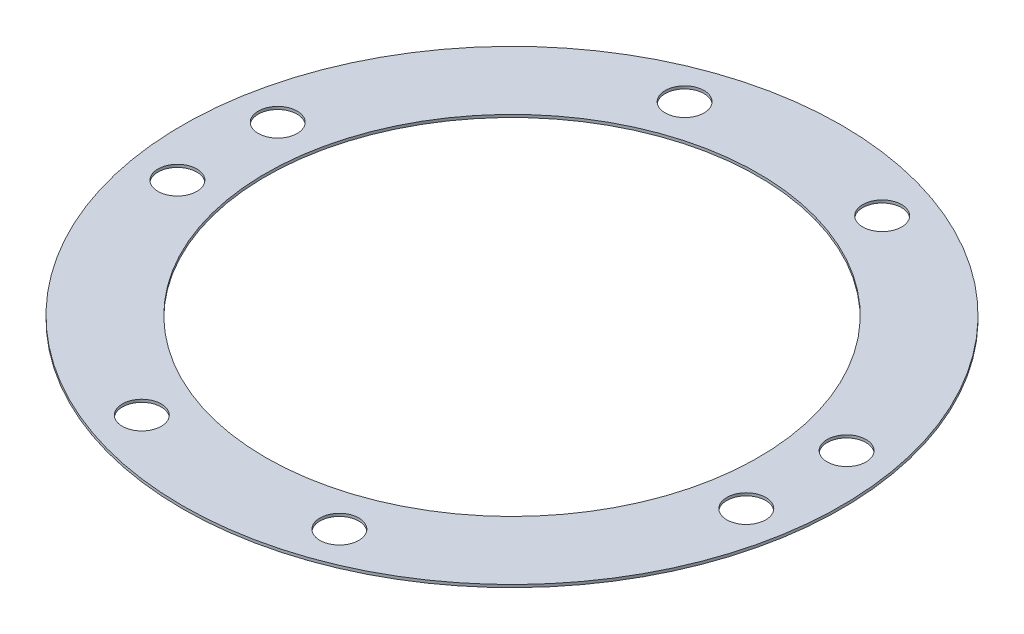
from build123d import *

# Parameters (mm, degrees)
SKETCH1_R          = 89
SKETCH1_R_2        = 66.5
SKETCH1_R_3        = 5.25
BASE_FLANGE1_DEPTH = 0.7366


# Sheet-metal steps are written as plain solids
with BuildPart() as part:
    # Sketch1 → Base-Flange1 (new body)
    with BuildSketch(Plane(origin=(0, 0, 0), x_dir=(1, 0, 0), z_dir=(0, 1, 0))):
        with Locations(Location((0, 0, 0), (0, 0, 270))):
            Circle(SKETCH1_R)
        with Locations(Location((0, 0, 0), (0, 0, 270))):
            Circle(SKETCH1_R_2, mode=Mode.SUBTRACT)
        with Locations(Location((26.677571179, 73.296024421, 0), (0, 0, 270))):
            Circle(SKETCH1_R_3, mode=Mode.SUBTRACT)
        with Locations(Location((-26.677571179, 73.296024421, 0), (0, 0, 270))):
            Circle(SKETCH1_R_3, mode=Mode.SUBTRACT)
        with Locations(Location((-76.815004735, 13.544557858, 0), (0, 0, 270))):
            Circle(SKETCH1_R_3, mode=Mode.SUBTRACT)
        with Locations(Location((-76.815004735, -13.544557858, 0), (0, 0, 270))):
            Circle(SKETCH1_R_3, mode=Mode.SUBTRACT)
        with Locations(Location((-26.677571179, -73.296024421, 0), (0, 0, 270))):
            Circle(SKETCH1_R_3, mode=Mode.SUBTRACT)
        with Locations(Location((26.677571179, -73.296024421, 0), (0, 0, 270))):
            Circle(SKETCH1_R_3, mode=Mode.SUBTRACT)
        with Locations(Location((76.815004735, 13.544557858, 0), (0, 0, 270))):
            Circle(SKETCH1_R_3, mode=Mode.SUBTRACT)
        with Locations(Location((76.815004735, -13.544557858, 0), (0, 0, 270))):
            Circle(SKETCH1_R_3, mode=Mode.SUBTRACT)
    extrude(amount=-BASE_FLANGE1_DEPTH)


solid = part.part
